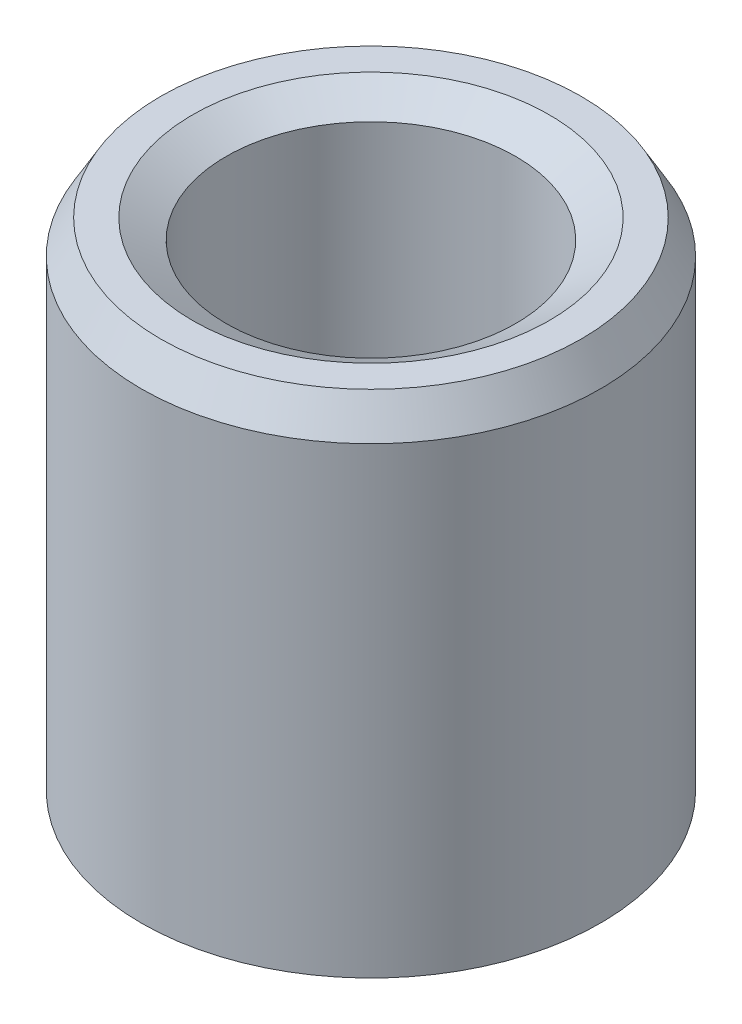
from build123d import *
from OCP.BRepFilletAPI import BRepFilletAPI_MakeChamfer

# Parameters (mm, degrees)
SKETCH1_R           = 17.5
BOSS_EXTRUDE1_DEPTH = 39.298058878
SKETCH2_R           = 11.039130397
CUT_EXTRUDE1_DEPTH  = 47.441763872
CHAMFER1_SIZE       = 2.553160163
CHAMFER1_SIZE2      = 1.474067708


with BuildPart() as part:
    # Sketch1 → Boss-Extrude1 (new body)
    with BuildSketch(Plane(origin=(0, 0, 0), x_dir=(1, 0, 0), z_dir=(0, 1, 0))):
        Circle(SKETCH1_R)
    extrude(amount=BOSS_EXTRUDE1_DEPTH)

    # Sketch2 → Cut-Extrude1 (cut, through all)
    with BuildSketch(Plane(origin=(0, 0, 0), x_dir=(1, 0, 0), z_dir=(0, 1, 0))):
        Circle(SKETCH2_R)
    extrude(amount=CUT_EXTRUDE1_DEPTH, mode=Mode.SUBTRACT)

    # Chamfer1: one chamfer whose edges measure the first distance from different faces: ONE call of the kernel's chamfer builder (chamfer() names one face for all edges)
    chamfer1_edges_1 = [part.edges().sort_by_distance(p)[0] for p in [
        (-11.039130397, 39.298058878, 0),
    ]]
    chamfer1_side_1 = [part.faces().sort_by_distance(p)[0] for p in [
        (-17.005025253, 39.298058878, 0),
    ]]
    chamfer1_edges_2 = [part.edges().sort_by_distance(p)[0] for p in [
        (-11.039130397, 0, 0),
    ]]
    chamfer1_side_2 = [part.faces().sort_by_distance(p)[0] for p in [
        (-11.039130397, 19.649029439, 0),
    ]]
    chamfer1_edges_3 = [part.edges().sort_by_distance(p)[0] for p in [
        (-17.5, 0, 0),
    ]]
    chamfer1_side_3 = [part.faces().sort_by_distance(p)[0] for p in [
        (-17.005025253, 0, 0),
    ]]
    chamfer1_edges_4 = [part.edges().sort_by_distance(p)[0] for p in [
        (-17.5, 39.298058878, 0),
    ]]
    chamfer1_side_4 = [part.faces().sort_by_distance(p)[0] for p in [
        (-17.5, 19.649029439, 0),
    ]]
    chamfer1 = BRepFilletAPI_MakeChamfer(part.part.solid().wrapped)
    for e in chamfer1_edges_1:
        chamfer1.Add(CHAMFER1_SIZE, CHAMFER1_SIZE2, e.wrapped, chamfer1_side_1[0].wrapped)  # the first distance lies on this face
    for e in chamfer1_edges_2:
        chamfer1.Add(CHAMFER1_SIZE, CHAMFER1_SIZE2, e.wrapped, chamfer1_side_2[0].wrapped)  # the first distance lies on this face
    for e in chamfer1_edges_3:
        chamfer1.Add(CHAMFER1_SIZE, CHAMFER1_SIZE2, e.wrapped, chamfer1_side_3[0].wrapped)  # the first distance lies on this face
    for e in chamfer1_edges_4:
        chamfer1.Add(CHAMFER1_SIZE, CHAMFER1_SIZE2, e.wrapped, chamfer1_side_4[0].wrapped)  # the first distance lies on this face
    add(Compound.cast(chamfer1.Shape()), mode=Mode.REPLACE)


solid = part.part
